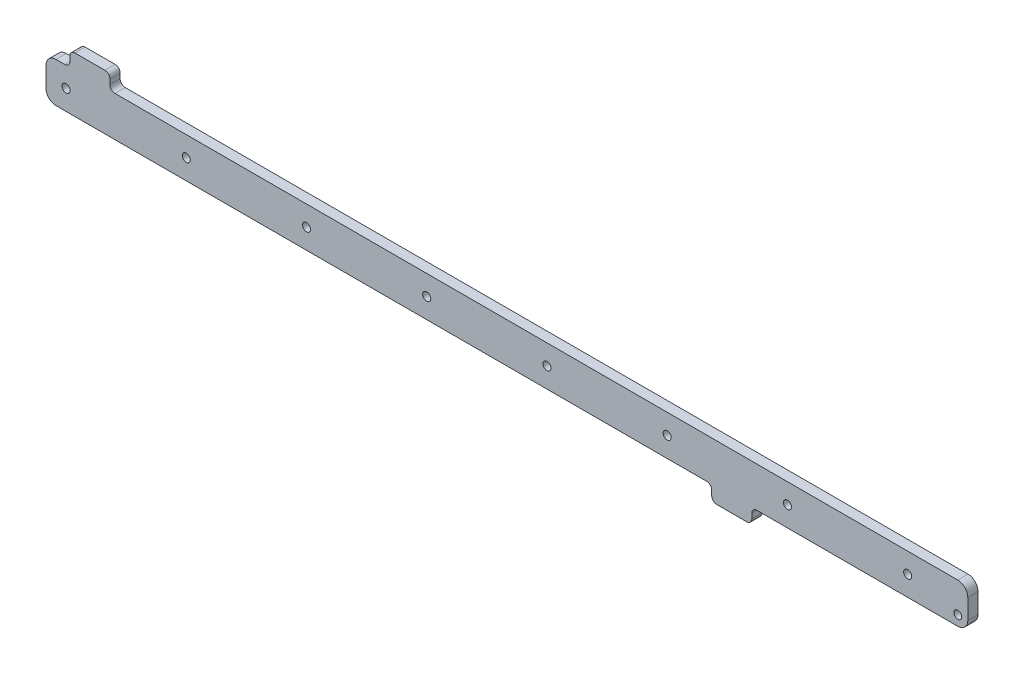
from build123d import *

# Parameters (mm, degrees)
SKETCH1_R                                          = 2.4892
BOSS_EXTRUDE1_DEPTH                                = 6.477
FILLET2_R                                          = 6.35
CSK_FOR_10_FLAT_HEAD_MACHINE_SCREW_100_D           = 5.1054
CSK_FOR_10_FLAT_HEAD_MACHINE_SCREW_100_CSINK_D     = 9.779
CSK_FOR_10_FLAT_HEAD_MACHINE_SCREW_100_CSINK_ANGLE = 100
LPATTERN1_COUNT                                    = 8
LPATTERN1_PITCH                                    = 76.2
FILLET3_R                                          = 3.175


with BuildPart() as part:
    # Sketch1 → Boss-Extrude1 (new body)
    with BuildSketch(Plane.XY):
        Polygon((0, 25.4), (0, 0), (40.53078, 0), (421.903292844, 0), (421.903292844, -9.525), (447.303292844, -9.525), (447.303292844, 0), (584.2, 0), (584.2, 25.4), (40.530665192, 25.4), (40.530665192, 34.925), (15.130665192, 34.925), (15.130665192, 25.4), align=None)
        with Locations((577.85, 6.35)):
            Circle(SKETCH1_R, mode=Mode.SUBTRACT)
    extrude(amount=BOSS_EXTRUDE1_DEPTH)

    # Fillet2
    fillet2_edges = [part.edges().sort_by_distance(p)[0] for p in [
        (0, 0, 3.2385),
        (0, 25.4, 3.2385),
        (584.2, 25.4, 3.2385),
        (584.2, 0, 3.2385),
    ]]
    fillet(fillet2_edges, radius=FILLET2_R)

    # CSK for #10 Flat Head Machine Screw (100)1 (through all)
    with Locations(Plane.XY.offset(6.477)):
        with Locations((546.1, 12.7)):
            csk_for_10_flat_head_machine_screw_100 = CounterSinkHole(CSK_FOR_10_FLAT_HEAD_MACHINE_SCREW_100_D / 2, CSK_FOR_10_FLAT_HEAD_MACHINE_SCREW_100_CSINK_D / 2, counter_sink_angle=CSK_FOR_10_FLAT_HEAD_MACHINE_SCREW_100_CSINK_ANGLE)

    # LPattern1: CSK for #10 Flat Head Machine Screw (100)1 ×8
    with Locations(*[(-i * LPATTERN1_PITCH, 0, 0) for i in range(1, LPATTERN1_COUNT)]):
        add(csk_for_10_flat_head_machine_screw_100, mode=Mode.SUBTRACT)


with BuildPart() as body_2:
    # Mirror2: mirrored copy
    add(part.part.mirror(Plane.XY))

    # Fillet3
    fillet3_edges = [body_2.edges().sort_by_distance(p)[0] for p in [
        (447.303292844, 0, -3.2385),
        (447.303292844, -9.525, -3.2385),
        (421.903292844, -9.525, -3.2385),
        (421.903292844, 0, -3.2385),
        (40.530665192, 25.4, -3.2385),
        (40.530665192, 34.925, -3.2385),
        (15.130665192, 34.925, -3.2385),
        (15.130665192, 25.4, -3.2385),
    ]]
    fillet(fillet3_edges, radius=FILLET3_R)


solid = body_2.part
